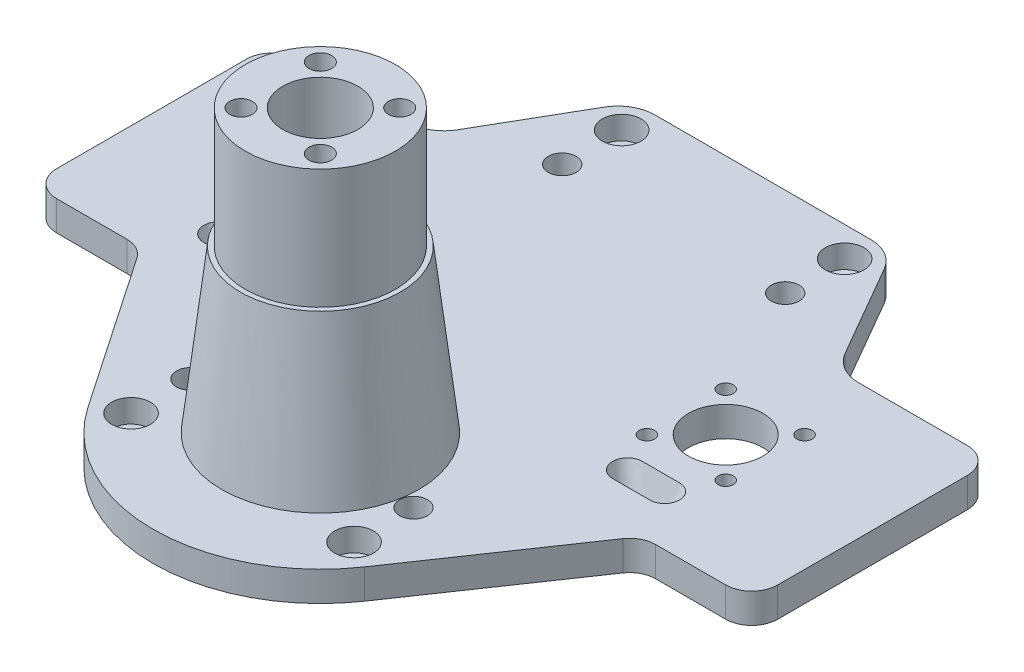
from build123d import *

# Parameters (mm, degrees)
MAIN_BODY_DEPTH                 = 8
SKETCH3_R                       = 21.5
FRONT_EXTRUSION_DEPTH           = 75.7
FRONT_LOFT_R                    = 21.5
BACK_LOFT_R                     = 26.5
SKETCH4_R                       = 10.1
SKETCH4_R_2                     = 10
SKETCH4_R_3                     = 3.05
SKETCH4_R_4                     = 3.75
SKETCH4_R_5                     = 2.05
BOLT_HOLES_DEPTH                = 175.904819384
SKETCH5_R                       = 4
BOLT_RECESSES_REAR_DEPTH        = 13
SKETCH6_R                       = 5.2
BOLT_RECESSES_FRONT_DEPTH       = 6.2
CUT_EXTRUDE1_START              = -32.2
SKETCH7_R                       = 21.5
SKETCH7_R_2                     = 20.2
CUT_EXTRUDE1_DEPTH              = 32.2
SKETCH8_R                       = 3.55
MOTOR_BOLT_HEAD_RECESSES_DEPTH  = 4.1
SKETCH9_R                       = 2
HEAT_SET_INSERT_HOLES_DEPTH     = 6
SKETCH10_R                      = 1.6
PCB_HEAT_SET_INSERT_HOLES_DEPTH = 4
SKETCH11_R                      = 2
CUT_EXTRUDE2_DEPTH              = 6


with BuildPart() as part:
    # Sketch1 → Main Body (new body)
    with BuildSketch(Plane(origin=(0, 0, 0), x_dir=(1, 0, 0), z_dir=(0, 1, 0))):
        with BuildLine():
            Line((-60.773502692, 84.067232452), (-90, 84.067232452))
            ThreePointArc((-90, 84.067232452), (-94.949747468, 82.01697992), (-97, 77.067232452))
            Line((-97, 77.067232452), (-97, 26.067232452))
            ThreePointArc((-97, 26.067232452), (-94.949747468, 21.117484984), (-90, 19.067232452))
            Line((-90, 19.067232452), (-71.151873662, 19.067232452))
            ThreePointArc((-71.151873662, 19.067232452), (-67.880419667, 18.255737018), (-65.367471381, 16.00940067))
            Line((-65.367471381, 16.00940067), (-37.18544323, -25.342509974))
            ThreePointArc((-37.18544323, -25.342509974), (0, -45), (37.18544323, -25.342509974))
            Line((37.18544323, -25.342509974), (65.367471381, 16.00940067))
            ThreePointArc((65.367471381, 16.00940067), (67.880419667, 18.255737018), (71.151873662, 19.067232452))
            Line((71.151873662, 19.067232452), (90, 19.067232452))
            ThreePointArc((90, 19.067232452), (94.949747468, 21.117484984), (97, 26.067232452))
            Line((97, 26.067232452), (97, 77.067232452))
            ThreePointArc((97, 77.067232452), (94.949747468, 82.01697992), (90, 84.067232452))
            Line((90, 84.067232452), (60.773502692, 84.067232452))
            ThreePointArc((60.773502692, 84.067232452), (55.773502692, 85.406978414), (52.113248654, 89.067232452))
            Line((52.113248654, 89.067232452), (37.679491924, 114.067232452))
            ThreePointArc((37.679491924, 114.067232452), (34.019237886, 117.72748649), (29.019237886, 119.067232452))
            Line((29.019237886, 119.067232452), (-29.019237886, 119.067232452))
            ThreePointArc((-29.019237886, 119.067232452), (-34.019237886, 117.72748649), (-37.679491924, 114.067232452))
            Line((-37.679491924, 114.067232452), (-52.113248654, 89.067232452))
            ThreePointArc((-52.113248654, 89.067232452), (-55.773502692, 85.406978414), (-60.773502692, 84.067232452))
        make_face()
    extrude(amount=MAIN_BODY_DEPTH)

    # Sketch3 → Front Extrusion (add)
    with BuildSketch(Plane(origin=(0, 8, 0), x_dir=(1, 0, 0), z_dir=(0, 1, 0))):
        with Locations(Location((0, 0, 0), (0, 0, 270))):
            Circle(SKETCH3_R)
    extrude(amount=FRONT_EXTRUSION_DEPTH)

    # Front Loft → Lofted Taper section 0
    with BuildSketch(Plane(origin=(0, 51.5, 0), x_dir=(1, 0, 0), z_dir=(0, 1, 0))):
        Circle(FRONT_LOFT_R)
    # Back Loft → Lofted Taper section 1
    with BuildSketch(Plane(origin=(0, 8, 0), x_dir=(1, 0, 0), z_dir=(0, 1, 0))):
        Circle(BACK_LOFT_R)
    loft()

    # Sketch4 → Bolt Holes (cut, through all)
    with BuildSketch(Plane.XZ):
        with Locations(Location((0, 0, 0), (0, 0, 270))):
            Circle(SKETCH4_R)
        with Locations(Location((-55, -54.067232452, 0), (0, 0, 270))):
            Circle(SKETCH4_R_2)
        with Locations(Location((-10.677312396, 10.677312396, 0), (0, 0, 270))):
            Circle(SKETCH4_R_3)
        with Locations(Location((-30, -95.067232452, 0), (0, 0, 270))):
            Circle(SKETCH4_R_4)
        with Locations(Location((-10.677312396, -10.677312396, 0), (0, 0, 270))):
            Circle(SKETCH4_R_3)
        with Locations(Location((-65.606601718, -43.460630734, 0), (0, 0, 270))):
            Circle(SKETCH4_R_5)
        with Locations(Location((-65.606601718, -64.67383417, 0), (0, 0, 270))):
            Circle(SKETCH4_R_5)
        with Locations(Location((-44.393398282, -64.67383417, 0), (0, 0, 270))):
            Circle(SKETCH4_R_5)
        with Locations(Location((-44.393398282, -43.460630734, 0), (0, 0, 270))):
            Circle(SKETCH4_R_5)
        with Locations(Location((55, -54.067232452, 0), (0, 0, 270))):
            Circle(SKETCH4_R_2)
        with Locations(Location((65.606601718, -64.67383417, 0), (0, 0, 270))):
            Circle(SKETCH4_R_5)
        with Locations(Location((44.393398282, -64.67383417, 0), (0, 0, 270))):
            Circle(SKETCH4_R_5)
        with Locations(Location((44.393398282, -43.460630734, 0), (0, 0, 270))):
            Circle(SKETCH4_R_5)
        with Locations(Location((65.606601718, -43.460630734, 0), (0, 0, 270))):
            Circle(SKETCH4_R_5)
        with Locations(Location((10.677312396, -10.677312396, 0), (0, 0, 270))):
            Circle(SKETCH4_R_3)
        with Locations(Location((10.677312396, 10.677312396, 0), (0, 0, 270))):
            Circle(SKETCH4_R_3)
        with Locations(Location((-30, -111.067232452, 0), (0, 0, 270))):
            Circle(SKETCH4_R_3)
        with Locations(Location((-30, 20.932767548, 0), (0, 0, 270))):
            Circle(SKETCH4_R_3)
        with Locations(Location((30, -111.067232452, 0), (0, 0, 270))):
            Circle(SKETCH4_R_3)
        with Locations(Location((30, 20.932767548, 0), (0, 0, 270))):
            Circle(SKETCH4_R_3)
        with Locations(Location((-30, 4.932767548, 0), (0, 0, 270))):
            Circle(SKETCH4_R_4)
        with Locations(Location((30, -95.067232452, 0), (0, 0, 270))):
            Circle(SKETCH4_R_4)
        with Locations(Location((30, 4.932767548, 0), (0, 0, 270))):
            Circle(SKETCH4_R_4)
    extrude(amount=-BOLT_HOLES_DEPTH, mode=Mode.SUBTRACT)

    # Sketch5 → Bolt Recesses Rear (cut)
    with BuildSketch(Plane.XZ):
        with Locations(Location((-10.677312396, 10.677312396, 0), (0, 0, 270))):
            Circle(SKETCH5_R)
        with Locations(Location((10.677312396, 10.677312396, 0), (0, 0, 270))):
            Circle(SKETCH5_R)
        with Locations(Location((10.677312396, -10.677312396, 0), (0, 0, 270))):
            Circle(SKETCH5_R)
        with Locations(Location((-10.677312396, -10.677312396, 0), (0, 0, 270))):
            Circle(SKETCH5_R)
    extrude(amount=-BOLT_RECESSES_REAR_DEPTH, mode=Mode.SUBTRACT)

    # Sketch6 → Bolt Recesses Front (cut)
    with BuildSketch(Plane(origin=(0, 8, 0), x_dir=(1, 0, 0), z_dir=(0, 1, 0))):
        with Locations(Location((30, 111.067232452, 0), (0, 0, 270))):
            Circle(SKETCH6_R)
        with Locations(Location((-30, 111.067232452, 0), (0, 0, 270))):
            Circle(SKETCH6_R)
        with Locations(Location((-30, -20.932767548, 0), (0, 0, 270))):
            Circle(SKETCH6_R)
        with Locations(Location((30, -20.932767548, 0), (0, 0, 270))):
            Circle(SKETCH6_R)
    extrude(amount=-BOLT_RECESSES_FRONT_DEPTH, mode=Mode.SUBTRACT)

    # Sketch7 → Cut-Extrude1 (cut)
    with BuildSketch(Plane(origin=(0, 83.7, 0), x_dir=(1, 0, 0), z_dir=(0, 1, 0)).offset(CUT_EXTRUDE1_START)):
        Circle(SKETCH7_R)
        with Locations(Location((0, 0, 0), (0, 0, 270))):
            Circle(SKETCH7_R_2, mode=Mode.SUBTRACT)
    extrude(amount=CUT_EXTRUDE1_DEPTH, mode=Mode.SUBTRACT)

    # Sketch8 → Motor bolt head recesses (cut)
    with BuildSketch(Plane.XZ):
        with Locations(Location((-65.606601718, -43.460630734, 0), (0, 0, 270))):
            Circle(SKETCH8_R)
        with Locations(Location((-44.393398282, -43.460630734, 0), (0, 0, 270))):
            Circle(SKETCH8_R)
        with Locations(Location((-44.393398282, -64.67383417, 0), (0, 0, 270))):
            Circle(SKETCH8_R)
        with Locations(Location((-65.606601718, -64.67383417, 0), (0, 0, 270))):
            Circle(SKETCH8_R)
        with Locations(Location((44.393398282, -64.67383417, 0), (0, 0, 90))):
            Circle(SKETCH8_R)
        with Locations(Location((44.393398282, -43.460630734, 0), (0, 0, 90))):
            Circle(SKETCH8_R)
        with Locations(Location((65.606601718, -64.67383417, 0), (0, 0, 90))):
            Circle(SKETCH8_R)
        with Locations(Location((65.606601718, -43.460630734, 0), (0, 0, 90))):
            Circle(SKETCH8_R)
    extrude(amount=-MOTOR_BOLT_HEAD_RECESSES_DEPTH, mode=Mode.SUBTRACT)

    # Sketch9 → Heat-set insert holes (cut)
    with BuildSketch(Plane.XZ):
        with Locations(Location((-90.5, -76.567232452, 0), (0, 0, 270))):
            Circle(SKETCH9_R)
        with Locations(Location((-90.5, -29.567232452, 0), (0, 0, 270))):
            Circle(SKETCH9_R)
        with Locations(Location((90.5, -76.567232452, 0), (0, 0, 90))):
            Circle(SKETCH9_R)
        with Locations(Location((90.5, -29.567232452, 0), (0, 0, 90))):
            Circle(SKETCH9_R)
        with Locations(Location((-42.5, -88.567232452, 0), (0, 0, 270))):
            Circle(SKETCH9_R)
        with Locations(Location((-42.5, -17.567232452, 0), (0, 0, 90))):
            Circle(SKETCH9_R)
        with Locations(Location((42.5, -88.567232452, 0), (0, 0, 90))):
            Circle(SKETCH9_R)
        with Locations(Location((42.5, -17.567232452, 0), (0, 0, 270))):
            Circle(SKETCH9_R)
    extrude(amount=-HEAT_SET_INSERT_HOLES_DEPTH, mode=Mode.SUBTRACT)

    # Sketch10 → PCB Heat-set insert holes (cut)
    with BuildSketch(Plane.XZ):
        with Locations(Location((-80, -79.067232452, 0), (0, 0, 270))):
            Circle(SKETCH10_R)
        with Locations(Location((-80, -29.067232452, 0), (0, 0, 270))):
            Circle(SKETCH10_R)
        with Locations(Location((-30, -29.067232452, 0), (0, 0, 270))):
            Circle(SKETCH10_R)
        with Locations(Location((-30, -79.067232452, 0), (0, 0, 270))):
            Circle(SKETCH10_R)
        with Locations(Location((80, -79.067232452, 0), (0, 0, 90))):
            Circle(SKETCH10_R)
        with Locations(Location((30, -79.067232452, 0), (0, 0, 90))):
            Circle(SKETCH10_R)
        with Locations(Location((30, -29.067232452, 0), (0, 0, 90))):
            Circle(SKETCH10_R)
        with Locations(Location((80, -29.067232452, 0), (0, 0, 90))):
            Circle(SKETCH10_R)
    extrude(amount=-PCB_HEAT_SET_INSERT_HOLES_DEPTH, mode=Mode.SUBTRACT)

    # Sketch11 → Cut-Extrude2 (cut)
    with BuildSketch(Plane(origin=(0, 0, -119.067232452), x_dir=(-1, 0, 0), z_dir=(0, 0, -1))):
        with Locations((-20, 4)):
            Circle(SKETCH11_R)
        with Locations((20, 4)):
            Circle(SKETCH11_R)
    extrude(amount=-CUT_EXTRUDE2_DEPTH, mode=Mode.SUBTRACT)

    # Cut-Loft4: read off the stored shape, not the designer's step
    # Cut-Loft4: loft between two sections, ruled curve by curve
    cut_loft4_from = [
        Edge.make_bspline([(-55, 8, -36.642947166), (-54.067894112, 8, -36.642947166), (-52.203682335, 8, -36.642947166), (-50.684298912, 8, -36.642947166), (-49.401884019, 8, -36.642947166), (-48.281359465, 8, -36.37704915), (-46.991070998, 8, -35.426717965), (-46.182967756, 8, -34.121618217), (-45.908480569, 8, -32.642947166), (-46.182967756, 8, -31.164276116), (-46.991070998, 8, -29.859176368), (-48.281359465, 8, -28.908845182), (-49.401884019, 8, -28.642947166), (-50.684298912, 8, -28.642947166), (-52.203682335, 8, -28.642947166), (-55, 8, -28.642947166), (-57.796317665, 8, -28.642947166), (-59.315701088, 8, -28.642947166), (-60.598115981, 8, -28.642947166), (-61.718640535, 8, -28.908845182), (-63.008929002, 8, -29.859176368), (-63.817032244, 8, -31.164276116), (-64.091519431, 8, -32.642947166), (-63.817032244, 8, -34.121618217), (-63.008929002, 8, -35.426717965), (-61.718640535, 8, -36.37704915), (-60.598115981, 8, -36.642947166), (-59.315701088, 8, -36.642947166), (-57.796317665, 8, -36.642947166), (-55.932105888, 8, -36.642947166), (-55, 8, -36.642947166)], [0.590971507, 0.590971507, 0.590971507, 0.590971507, 0.63645726, 0.681943013, 0.681943013, 0.721700137, 0.76145726, 0.801214383, 0.840971507, 0.88072863, 0.920485753, 0.960242877, 1, 1, 1.045485753, 1.090971507, 1.13645726, 1.181943013, 1.181943013, 1.221700137, 1.26145726, 1.301214383, 1.340971507, 1.38072863, 1.420485753, 1.460242877, 1.5, 1.5, 1.545485753, 1.590971507, 1.590971507, 1.590971507, 1.590971507], 3),
    ]
    cut_loft4_to = [
        Edge.make_bspline([(-55, 0, -34.449177917), (-54.622806763, 0, -34.449177917), (-53.868420288, 0, -34.449177917), (-53.032679734, 0, -34.449177917), (-52.034407762, 0, -34.449177917), (-51.066607295, 0, -34.284961957), (-49.716520071, 0, -33.469463734), (-48.739347515, 0, -32.123657552), (-48.379827484, 0, -30.449177917), (-48.739347515, 0, -28.774698283), (-49.716520071, 0, -27.4288921), (-51.066607295, 0, -26.613393877), (-52.034407762, 0, -26.449177917), (-53.032679734, 0, -26.449177917), (-53.868420288, 0, -26.449177917), (-55, 0, -26.449177917), (-56.131579712, 0, -26.449177917), (-56.967320266, 0, -26.449177917), (-57.965592238, 0, -26.449177917), (-58.933392705, 0, -26.613393877), (-60.283479929, 0, -27.4288921), (-61.260652485, 0, -28.774698283), (-61.620172516, 0, -30.449177917), (-61.260652485, 0, -32.123657552), (-60.283479929, 0, -33.469463734), (-58.933392705, 0, -34.284961957), (-57.965592238, 0, -34.449177917), (-56.967320266, 0, -34.449177917), (-56.131579712, 0, -34.449177917), (-55.377193237, 0, -34.449177917), (-55, 0, -34.449177917)], [0.590971507, 0.590971507, 0.590971507, 0.590971507, 0.63645726, 0.681943013, 0.681943013, 0.721700137, 0.76145726, 0.801214383, 0.840971507, 0.88072863, 0.920485753, 0.960242877, 1, 1, 1.045485753, 1.090971507, 1.13645726, 1.181943013, 1.181943013, 1.221700137, 1.26145726, 1.301214383, 1.340971507, 1.38072863, 1.420485753, 1.460242877, 1.5, 1.5, 1.545485753, 1.590971507, 1.590971507, 1.590971507, 1.590971507], 3),
    ]
    cut_loft4 = Solid(Shell([*[Face.make_surface_from_curves(cut_loft4_from[k], cut_loft4_to[k]) for k in range(1)], Face(Wire(cut_loft4_from)), Face(Wire(cut_loft4_to))]))
    add(cut_loft4, mode=Mode.SUBTRACT)

    # Mirror1: Cut-Loft4 across plane
    add(cut_loft4.mirror(Plane(origin=(0, 0, 0), x_dir=(0, 0, 1), z_dir=(1, 0, 0))), mode=Mode.SUBTRACT)


solid = part.part
